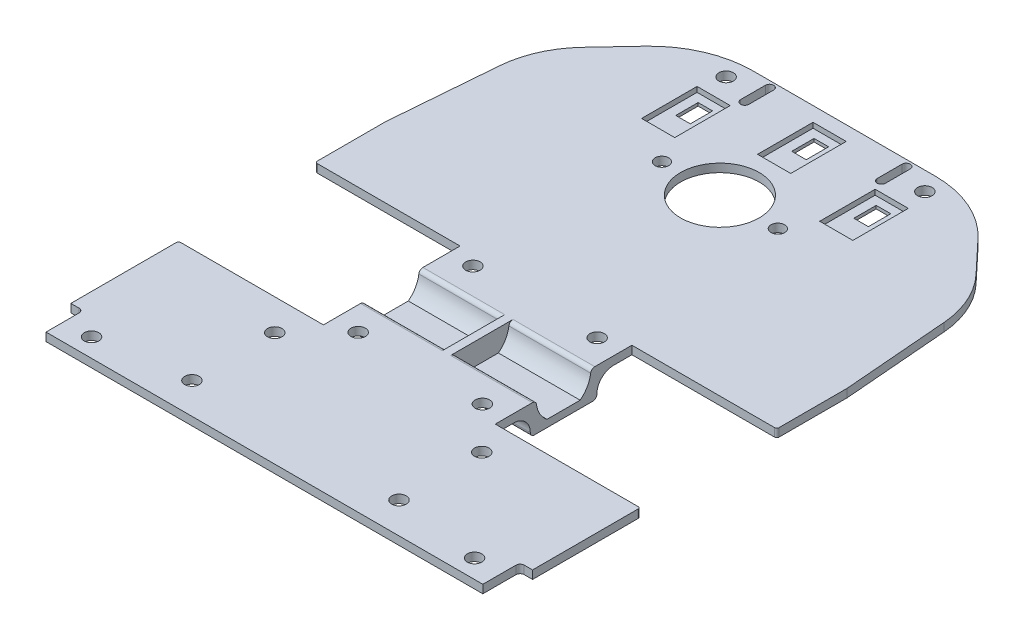
from build123d import *
from OCP.BRepFilletAPI import BRepFilletAPI_MakeFillet

# Parameters (mm, degrees)
SKETCH1_R               = 1.75
SKETCH1_R_2             = 1.65
SKETCH1_R_3             = 9.5
BOSS_EXTRUDE1_DEPTH     = 2
CUT_EXTRUDE1_DEPTH      = 41.5
BOSS_EXTRUDE2_DEPTH     = 41.5
SKETCH6_W               = 16.079745626
SKETCH6_H               = 7
BOSS_EXTRUDE3_DEPTH     = 1
FILLET1_R               = 4
FILLET1_R_2             = 1
SKETCH7_R               = 1.75
CUT_EXTRUDE2_DEPTH      = 90.76114137
FILLET2_R               = 0.5
CUT_EXTRUDE3_DEPTH      = 90.76114137
SKETCH9_W               = 8.01
SKETCH9_H               = 13.4
SKETCH9_W_2             = 3.51
SKETCH9_H_2             = 5.4
CUT_EXTRUDE4_DEPTH      = 1.25
SKETCH9_4_W             = 3.51
SKETCH9_4_H             = 5.4
CUT_EXTRUDE5_DEPTH      = 90.76114137
ENL_V_MAT_EXTRU_1_DEPTH = 90.627353526


with BuildPart() as part:
    # Sketch1 → Boss-Extrude1 (new body)
    with BuildSketch(Plane(origin=(0, 0, 0), x_dir=(1, 0, 0), z_dir=(0, 1, 0))):
        with BuildLine():
            Line((-22, 70), (22, 70))
            ThreePointArc((22, 70), (31.924250474, 67.945789429), (40.217580929, 62.120740202))
            Line((40.217580929, 62.120740202), (47.510174455, 54.360946457))
            ThreePointArc((47.510174455, 54.360946457), (51.771291303, 47.94288813), (53.674026321, 40.47775659))
            Line((53.674026321, 40.47775659), (55.75, 15))
            Line((55.75, 15), (55.75, -2))
            Line((55.75, -2), (20.75, -2))
            Line((20.75, -2), (20.75, -35))
            Line((20.75, -35), (55.75, -35))
            Line((55.75, -35), (55.75, -70))
            Line((55.75, -70), (-55.75, -70))
            Line((-55.75, -70), (-55.75, -35))
            Line((-55.75, -35), (-20.75, -35))
            Line((-20.75, -35), (-20.75, -2))
            Line((-20.75, -2), (-55.75, -2))
            Line((-55.75, -2), (-55.75, 15))
            Line((-55.75, 15), (-53.674026321, 40.47775659))
            ThreePointArc((-53.674026321, 40.47775659), (-51.771291303, 47.94288813), (-47.510174455, 54.360946457))
            Line((-47.510174455, 54.360946457), (-40.217580929, 62.120740202))
            ThreePointArc((-40.217580929, 62.120740202), (-31.924250474, 67.945789429), (-22, 70))
        make_face()
        with Locations(Location((-46.25, -65.5, 0), (0, 0, 270))):
            Circle(SKETCH1_R, mode=Mode.SUBTRACT)
        with Locations(Location((46.25, -65.5, 0), (0, 0, 270))):
            Circle(SKETCH1_R, mode=Mode.SUBTRACT)
        with Locations(Location((-24, 65.5, 0), (0, 0, 270))):
            Circle(SKETCH1_R, mode=Mode.SUBTRACT)
        with Locations(Location((24, 65.5, 0), (0, 0, 270))):
            Circle(SKETCH1_R, mode=Mode.SUBTRACT)
        with Locations(Location((-25, -42.5, 0), (0, 0, 270))):
            Circle(SKETCH1_R, mode=Mode.SUBTRACT)
        with Locations(Location((-25, -62.5, 0), (0, 0, 270))):
            Circle(SKETCH1_R, mode=Mode.SUBTRACT)
        with Locations(Location((25, -42.5, 0), (0, 0, 270))):
            Circle(SKETCH1_R, mode=Mode.SUBTRACT)
        with Locations(Location((25, -62.5, 0), (0, 0, 270))):
            Circle(SKETCH1_R, mode=Mode.SUBTRACT)
        with Locations(Location((-14, 40, 0), (0, 0, 270))):
            Circle(SKETCH1_R_2, mode=Mode.SUBTRACT)
        with Locations(Location((14, 40, 0), (0, 0, 270))):
            Circle(SKETCH1_R_2, mode=Mode.SUBTRACT)
        with Locations(Location((0, 40, 0), (0, 0, 270))):
            Circle(SKETCH1_R_3, mode=Mode.SUBTRACT)
    extrude(amount=BOSS_EXTRUDE1_DEPTH)

    # Sketch5 → Cut-Extrude1 (cut)
    with BuildSketch(Plane(origin=(20.75, 0, 0), x_dir=(0, 0, -1), z_dir=(1, 0, 0))):
        with BuildLine():
            Line((-25.100189391, 2), (-11.899810609, 2))
            ThreePointArc((-11.899810609, 2), (-12.585473072, -0.929312414), (-14.5, -3.25))
            Line((-14.5, -3.25), (-22.5, -3.25))
            ThreePointArc((-22.5, -3.25), (-24.414526928, -0.929312414), (-25.100189391, 2))
        make_face()
    extrude(amount=-CUT_EXTRUDE1_DEPTH, mode=Mode.SUBTRACT)


with BuildPart() as cut_extrude1_piece_1:
    # of the separate pieces the step leaves, piece 1, a body of its own (cut_extrude1_pieces)
    add(part.part.solids().sort_by_distance((-22, 0, -70))[0])



with BuildPart() as cut_extrude1_piece_2:
    # of the separate pieces the step leaves, piece 2, a body of its own (cut_extrude1_pieces)
    add(part.part.solids().sort_by_distance((-20.75, 0, 35))[0])

    # Sketch5<3> → Boss-Extrude2 (add)
    with BuildSketch(Plane(origin=(20.75, 0, 0), x_dir=(0, 0, -1), z_dir=(1, 0, 0))):
        with BuildLine():
            Line((-24.789872813, 0), (-26.539872813, 0))
            Line((-26.539872813, 0), (-26.539872813, -5))
            Line((-26.539872813, -5), (-10.460127187, -5))
            Line((-10.460127187, -5), (-10.460127187, 0))
            Line((-10.460127187, 0), (-12.210127187, 0))
            ThreePointArc((-12.210127187, 0), (-13.10453935, -1.801513432), (-14.5, -3.25))
            Line((-14.5, -3.25), (-22.5, -3.25))
            ThreePointArc((-22.5, -3.25), (-23.89546065, -1.801513432), (-24.789872813, 0))
        make_face()
    extrude(amount=-BOSS_EXTRUDE2_DEPTH)


with BuildPart() as cut_extrude1_piece_1_1:
    add(cut_extrude1_piece_1.part)

    add(cut_extrude1_piece_2.part)  # Boss-Extrude3 merges Cut-Extrude1 piece 2
    # Sketch6 → Boss-Extrude3 (add, symmetric)
    with BuildSketch(Plane(origin=(0, 0, 0), x_dir=(0, 0, -1), z_dir=(1, 0, 0))):
        with Locations((-18.5, -1.5)):
            Rectangle(SKETCH6_W, SKETCH6_H)
    extrude(amount=BOSS_EXTRUDE3_DEPTH, both=True)

    # Fillet1
    fillet1_edges_1 = [cut_extrude1_piece_1_1.edges().sort_by_distance(p)[0] for p in [
        (0, 0, 26.539872813),
        (0, 0, 10.460127187),
    ]]
    fillet1_edges_2 = [cut_extrude1_piece_1_1.edges().sort_by_distance(p)[0] for p in [
        (0, -5, 26.539872813),
        (0, -5, 10.460127187),
        (-10.875, 2, 25.100189391),
        (10.875, 2, 25.100189391),
        (10.875, 2, 11.899810609),
        (-10.875, 2, 11.899810609),
    ]]
    fillet1 = BRepFilletAPI_MakeFillet(cut_extrude1_piece_1_1.part.solid().wrapped)
    for e in fillet1_edges_1:
        fillet1.Add(FILLET1_R - 0.0001, e.wrapped)
    for e in fillet1_edges_2:
        fillet1.Add(FILLET1_R_2 - 0.0001, e.wrapped)
    add(Compound.cast(fillet1.Shape()), mode=Mode.REPLACE)  # a hair under: the kernel refuses the full size

    # Sketch7 → Cut-Extrude2 (cut, through all)
    with BuildSketch(Plane(origin=(0, 2, 0), x_dir=(1, 0, 0), z_dir=(0, 1, 0))):
        with Locations(Location((15, -4.64, 0), (0, 0, 270))):
            Circle(SKETCH7_R)
        with Locations(Location((-15, -4.64, 0), (0, 0, 90))):
            Circle(SKETCH7_R)
        with Locations(Location((-15, -32.36, 0), (0, 0, 270))):
            Circle(SKETCH7_R)
        with Locations(Location((15, -32.36, 0), (0, 0, 90))):
            Circle(SKETCH7_R)
    extrude(amount=-CUT_EXTRUDE2_DEPTH, mode=Mode.SUBTRACT)

    # Fillet2
    fillet2_edges = [cut_extrude1_piece_1_1.edges().sort_by_distance(p)[0] for p in [
        (-55.75, 1, 35),
        (55.75, 1, 35),
        (55.75, 1, 2),
        (-55.75, 1, 2),
    ]]
    fillet(fillet2_edges, radius=FILLET2_R)

    # Sketch8 → Cut-Extrude3 (cut, through all)
    with BuildSketch(Plane(origin=(0, 2, 0), x_dir=(1, 0, 0), z_dir=(0, 1, 0))):
        with BuildLine():
            Line((-55.75, -61), (-53.75, -61))
            ThreePointArc((-53.75, -61), (-53.042893219, -61.292893219), (-52.75, -62))
            Line((-52.75, -62), (-52.75, -70))
            Line((-52.75, -70), (-55.75, -70))
            Line((-55.75, -70), (-55.75, -61))
        make_face()
        with BuildLine():
            Line((55.75, -61), (53.75, -61))
            ThreePointArc((53.75, -61), (53.042893219, -61.292893219), (52.75, -62))
            Line((52.75, -62), (52.75, -70))
            Line((52.75, -70), (55.75, -70))
            Line((55.75, -70), (55.75, -61))
        make_face()
    extrude(amount=-CUT_EXTRUDE3_DEPTH, mode=Mode.SUBTRACT)

    # Sketch9 → Cut-Extrude4 (cut)
    # profile 1 of 6: a face of its own
    with BuildSketch(Plane(origin=(0, 2, 0), x_dir=(1, 0, 0), z_dir=(0, 1, 0))):
        with Locations((-21.505, 53.3)):
            Rectangle(SKETCH9_W, SKETCH9_H)
        with Locations((-21.505, 55.3)):
            Rectangle(SKETCH9_W_2, SKETCH9_H_2, mode=Mode.SUBTRACT)
    # profile 2 of 6: a face of its own
    with BuildSketch(Plane(origin=(0, 2, 0), x_dir=(1, 0, 0), z_dir=(0, 1, 0))):
        with Locations((-21.505, 55.3)):
            Rectangle(SKETCH9_W_2, SKETCH9_H_2)
    # profile 3 of 6: a face of its own
    with BuildSketch(Plane(origin=(0, 2, 0), x_dir=(1, 0, 0), z_dir=(0, 1, 0))):
        with Locations((0, 59.8)):
            Rectangle(SKETCH9_W, SKETCH9_H)
        with Locations((0, 61.8)):
            Rectangle(SKETCH9_W_2, SKETCH9_H_2, mode=Mode.SUBTRACT)
    # profile 4 of 6: a face of its own
    with BuildSketch(Plane(origin=(0, 2, 0), x_dir=(1, 0, 0), z_dir=(0, 1, 0))):
        with Locations((0, 61.8)):
            Rectangle(SKETCH9_W_2, SKETCH9_H_2)
    # profile 5 of 6: a face of its own
    with BuildSketch(Plane(origin=(0, 2, 0), x_dir=(1, 0, 0), z_dir=(0, 1, 0))):
        with Locations((21.505, 53.3)):
            Rectangle(SKETCH9_W, SKETCH9_H)
        with Locations((21.505, 55.3)):
            Rectangle(SKETCH9_W_2, SKETCH9_H_2, mode=Mode.SUBTRACT)
    # profile 6 of 6: a face of its own
    with BuildSketch(Plane(origin=(0, 2, 0), x_dir=(1, 0, 0), z_dir=(0, 1, 0))):
        with Locations((21.505, 55.3)):
            Rectangle(SKETCH9_W_2, SKETCH9_H_2)
    extrude(amount=-CUT_EXTRUDE4_DEPTH, mode=Mode.SUBTRACT)

    # Sketch9<4> → Cut-Extrude5 (cut, through all)
    with BuildSketch(Plane(origin=(0, 2, 0), x_dir=(1, 0, 0), z_dir=(0, 1, 0))):
        with Locations((-21.505, 55.3)):
            Rectangle(SKETCH9_4_W, SKETCH9_4_H)
        with Locations((0, 61.8)):
            Rectangle(SKETCH9_4_W, SKETCH9_4_H)
        with Locations((21.505, 55.3)):
            Rectangle(SKETCH9_4_W, SKETCH9_4_H)
    extrude(amount=-CUT_EXTRUDE5_DEPTH, mode=Mode.SUBTRACT)

    # Esquisse1 → Enlèv. mat.-Extru.1 (cut, through all)
    with BuildSketch(Plane.XZ):
        with BuildLine():
            Line((17.25, -62.5), (17.25, -68.5))
            ThreePointArc((17.25, -68.5), (16.5, -69.25), (15.75, -68.5))
            Line((15.75, -68.5), (15.75, -62.5))
            ThreePointArc((15.75, -62.5), (16.5, -61.75), (17.25, -62.5))
        make_face()
        with BuildLine():
            Line((-17.25, -62.5), (-17.25, -68.5))
            ThreePointArc((-17.25, -68.5), (-16.5, -69.25), (-15.75, -68.5))
            Line((-15.75, -68.5), (-15.75, -62.5))
            ThreePointArc((-15.75, -62.5), (-16.5, -61.75), (-17.25, -62.5))
        make_face()
        with BuildLine():
            Line((17.5, -62.5), (17.5, -68.5))
            ThreePointArc((17.5, -68.5), (16.5, -69.5), (15.5, -68.5))
            Line((15.5, -68.5), (15.5, -62.5))
            ThreePointArc((15.5, -62.5), (16.5, -61.5), (17.5, -62.5))
        make_face()
        with BuildLine():
            Line((-17.5, -62.5), (-17.5, -68.5))
            ThreePointArc((-17.5, -68.5), (-16.5, -69.5), (-15.5, -68.5))
            Line((-15.5, -68.5), (-15.5, -62.5))
            ThreePointArc((-15.5, -62.5), (-16.5, -61.5), (-17.5, -62.5))
        make_face()
    extrude(amount=-ENL_V_MAT_EXTRU_1_DEPTH, mode=Mode.SUBTRACT)


solid = cut_extrude1_piece_1_1.part
